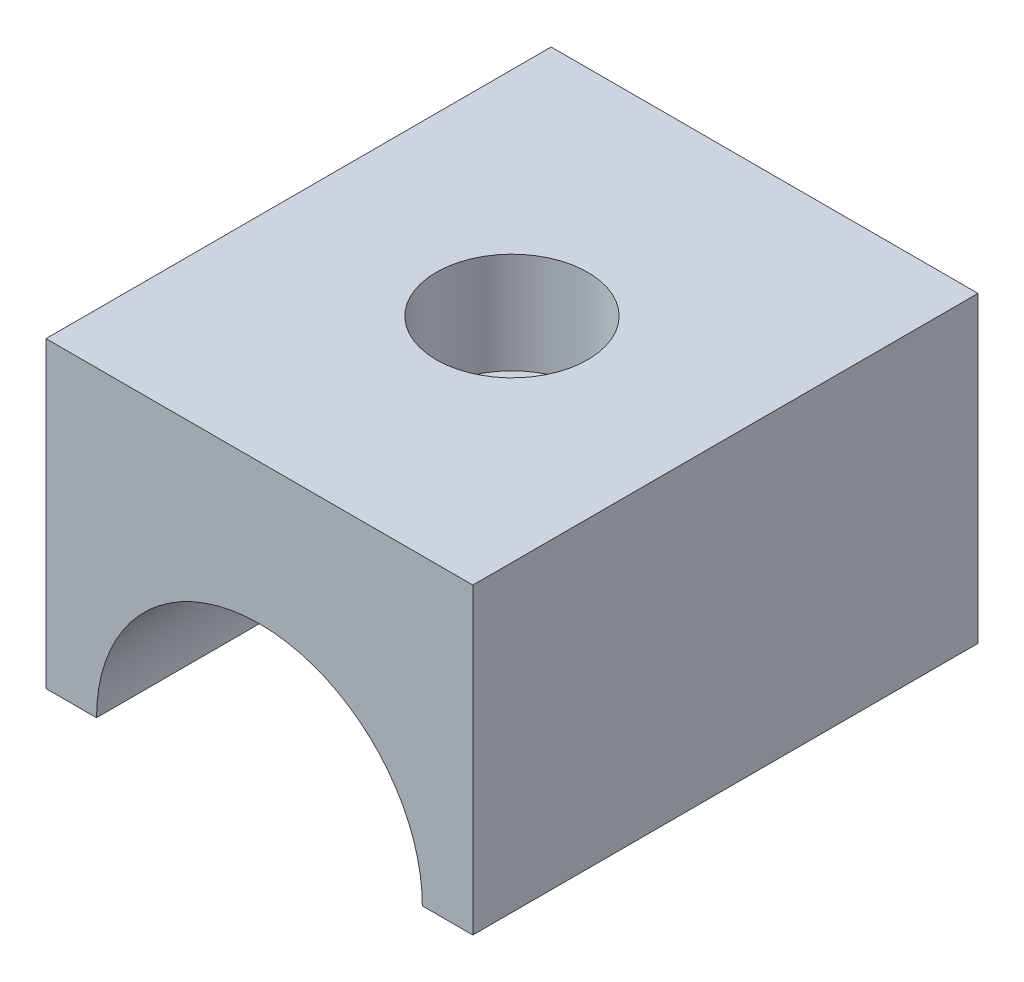
from build123d import *

# Parameters (mm, degrees)
BOSS_EXTRUDE1_DEPTH = 20
SKETCH3_R           = 1.6
CUT_EXTRUDE1_DEPTH  = 20
SKETCH4_R           = 3
CUT_EXTRUDE2_DEPTH  = 4


with BuildPart() as part:
    # Sketch2 → Boss-Extrude1 (new body)
    with BuildSketch(Plane.XY):
        with BuildLine():
            Line((0, 0), (-2, 0))
            Line((-2, 0), (-2, 12))
            Line((-2, 12), (14.9, 12))
            Line((14.9, 12), (14.9, 0))
            Line((14.9, 0), (12.9, 0))
            ThreePointArc((12.9, 0), (6.45, 6.45), (0, 0))
        make_face()
    extrude(amount=-BOSS_EXTRUDE1_DEPTH)

    # Sketch3 → Cut-Extrude1 (cut)
    with BuildSketch(Plane(origin=(0, 12, 0), x_dir=(1, 0, 0), z_dir=(0, 1, 0))):
        with Locations((6.45, 10)):
            Circle(SKETCH3_R)
    extrude(amount=-CUT_EXTRUDE1_DEPTH, mode=Mode.SUBTRACT)

    # Sketch4 → Cut-Extrude2 (cut)
    with BuildSketch(Plane(origin=(0, 12, 0), x_dir=(1, 0, 0), z_dir=(0, 1, 0))):
        with Locations((6.45, 10)):
            Circle(SKETCH4_R)
    extrude(amount=-CUT_EXTRUDE2_DEPTH, mode=Mode.SUBTRACT)


solid = part.part
